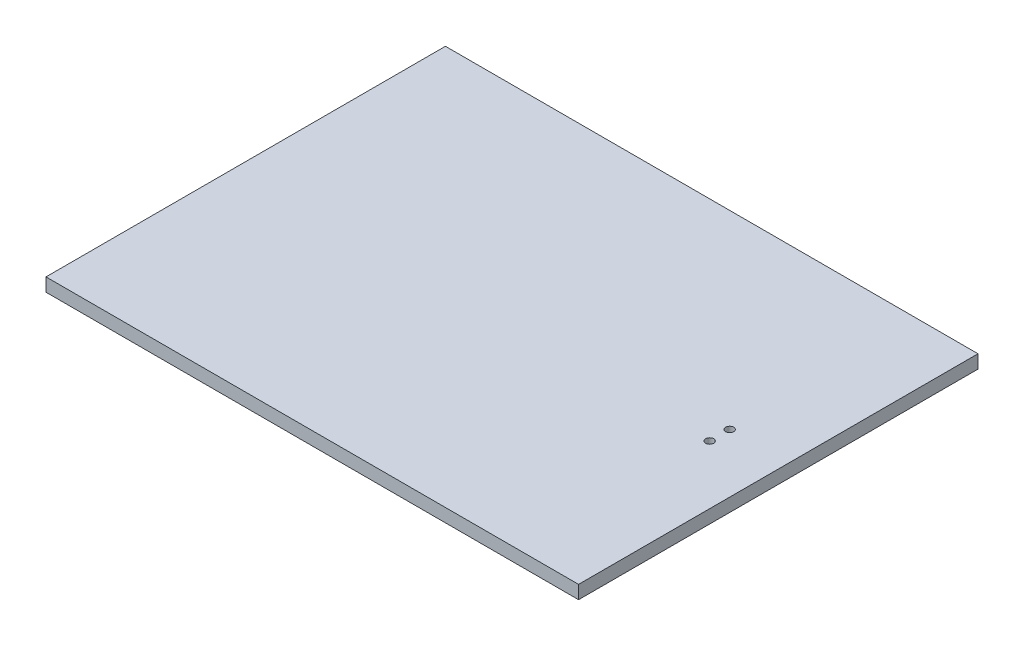
from build123d import *

# Parameters (mm, degrees)
BASE_PLATE_SKETCH_W = 400
BASE_PLATE_SKETCH_H = 300
BASE_PLATE_SKETCH_R = 3
BOSS_EXTRUDE1_DEPTH = 10


with BuildPart() as part:
    # base_plate_sketch → Boss-Extrude1 (new body)
    with BuildSketch(Plane(origin=(0, 0, 0), x_dir=(1, 0, 0), z_dir=(0, 1, 0))):
        Rectangle(BASE_PLATE_SKETCH_W, BASE_PLATE_SKETCH_H)
        with Locations((156, 7.5)):
            Circle(BASE_PLATE_SKETCH_R, mode=Mode.SUBTRACT)
        with Locations((156, -7.5)):
            Circle(BASE_PLATE_SKETCH_R, mode=Mode.SUBTRACT)
    extrude(amount=BOSS_EXTRUDE1_DEPTH)


solid = part.part
